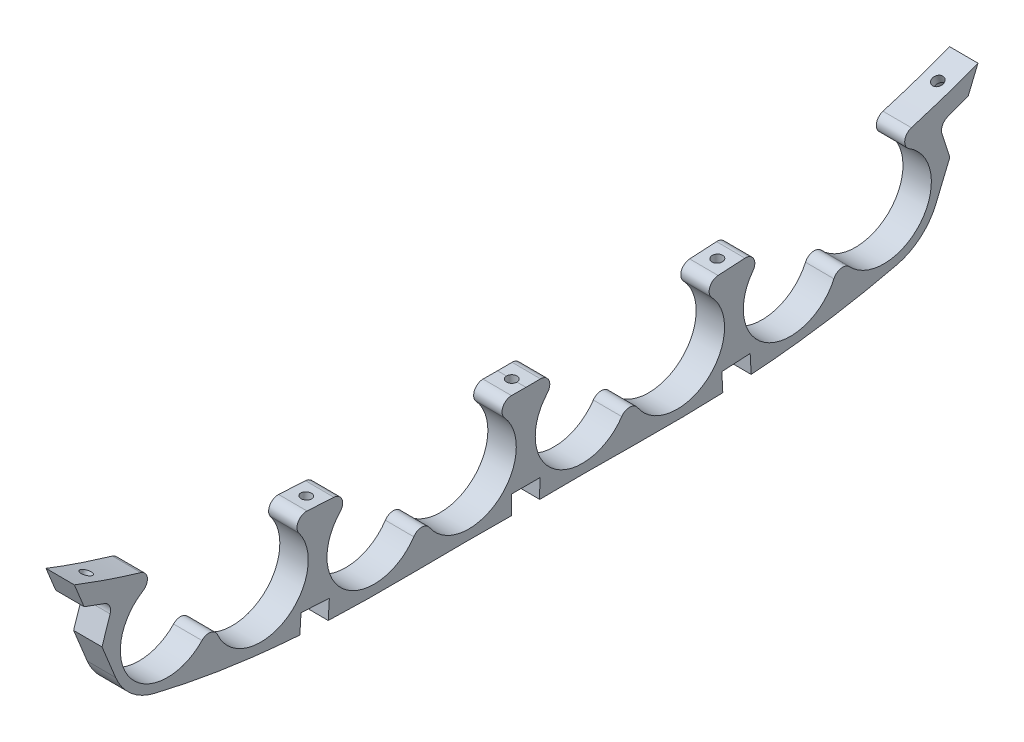
from build123d import *

# Parameters (mm, degrees)
BOSS_EXTRUDE2_START = -4.7625
BOSS_EXTRUDE2_DEPTH = 9.525
CUT_EXTRUDE1_DEPTH  = 156.415453264
SKETCH3_R           = 1.778
CUT_EXTRUDE2_DEPTH  = 156.084029674
SKETCH4_R           = 1.778
CUT_EXTRUDE3_DEPTH  = 154.633346002
SKETCH5_R           = 3.175
CUT_EXTRUDE4_DEPTH  = 3.556
SKETCH6_R           = 1.778
CUT_EXTRUDE5_DEPTH  = 141.617711282


# Read off the part's stored shape, not the designer's step: Boss-Extrude2
with BuildPart() as part:
    # Boss-Extrude2 outline → Boss-Extrude2 (new body)
    with BuildSketch(Plane(origin=(-4.793989049, 0.020738597, -8e-09), x_dir=(-1.5740645192279891e-09, 3.5988585896806374e-12, 1.0), z_dir=(-0.9999906431736159, 0.00432591784689156, -1.5740653593461668e-09)).offset(BOSS_EXTRUDE2_START)):
        with BuildLine():
            Line((-138.072044535, -17.418672385), (-133.45193308, -28.653173914))
            ThreePointArc((-133.45193308, -28.653173914), (-128.289952655, -35.791230264), (-120.447393147, -39.802732565))
            add(Edge.make_bspline(
                [(-120.447393147, -39.802732565), (-119.532951115, -40.023476944), (-117.088169027, -40.601323697), (-110.953698267, -41.968369708), (-101.9631708, -43.710437587), (-90.800466979, -45.403836777), (-79.689088478, -46.662973433), (-68.62645086, -47.527275454), (-57.58924724, -48.037878216), (-46.678774083, -48.224931934), (-36.12400945, -48.204712413), (-25.891642086, -48.098211972), (-17.621930281, -48.025348577), (-11.245188421, -48.026081616), (-6.353163032, -48.062670944), (-2.777855823, -48.097005295), (-0.863208778, -48.112845404), (-0.665350758, -48.114448781)],
                knots=[0.270797205, 0.270797205, 0.270797205, 0.270797205, 0.286422205, 0.3125, 0.375, 0.4375, 0.5, 0.5625, 0.625, 0.6875, 0.75, 0.8125, 0.875, 0.90625, 0.9375, 0.96875, 0.972344137, 0.972344137, 0.972344137, 0.972344137], degree=3))
            Line((-0.665350758, -48.114448781), (-0.665350758, -41.793027475))
            Line((-0.665350758, -41.793027475), (4.097149249, -41.793027475))
            Line((4.097149249, -41.793027475), (4.097149249, -13.091259669))
            add(Edge.make_bspline(
                [(-0.77284529, -13.060384989), (0.850702359, -13.073891325), (2.474025926, -13.085351705), (4.097149249, -13.091259669)],
                knots=[0.969923956, 0.969923956, 0.969923956, 0.969923956, 1, 1, 1, 1], degree=3))
            ThreePointArc((-0.77284529, -13.060384989), (-3.639917153, -14.954181234), (-3.104472125, -18.348273735))
            ThreePointArc((-3.104472125, -18.348273735), (-5.224674561, -41.458905114), (-28.135499878, -37.75882074))
            ThreePointArc((-28.135499878, -37.75882074), (-30.788793596, -36.352857657), (-33.427092785, -37.786760419))
            ThreePointArc((-33.427092785, -37.786760419), (-56.555344229, -41.528795139), (-58.222773785, -18.159188437))
            ThreePointArc((-58.222773785, -18.159188437), (-57.571640051, -14.813961347), (-60.325385318, -12.806125092))
            add(Edge.make_bspline(
                [(-69.337142456, -12.29114456), (-66.34151202, -12.505674943), (-63.337824033, -12.676142272), (-60.325385318, -12.806125092)],
                knots=[0.544342528, 0.544342528, 0.544342528, 0.544342528, 0.601001878, 0.601001878, 0.601001878, 0.601001878], degree=3))
            ThreePointArc((-69.337142456, -12.29114456), (-72.301979587, -13.96996524), (-72.039404171, -17.366986324))
            ThreePointArc((-72.039404171, -17.366986324), (-76.727036431, -40.596572868), (-99.26938115, -33.286970841))
            ThreePointArc((-99.26938115, -33.286970841), (-101.634862692, -31.437323087), (-104.483804941, -32.386126439))
            ThreePointArc((-104.483804941, -32.386126439), (-128.322582254, -31.527253859), (-124.396922416, -7.998247065))
            ThreePointArc((-124.396922416, -7.998247065), (-122.920666522, -4.906404126), (-125.113082538, -2.273509096))
            add(Edge.make_bspline(
                [(-147.427204302, 5.329817062), (-146.245143462, 4.87057829), (-145.060729116, 4.420056913), (-140.77844611, 2.824904825), (-137.662571865, 1.726883825), (-131.406857013, -0.357749795), (-128.269220076, -1.343570319), (-125.113082538, -2.273509096)],
                knots=[0.038524248, 0.038524248, 0.038524248, 0.038524248, 0.0625, 0.0625, 0.125, 0.125, 0.18699398, 0.18699398, 0.18699398, 0.18699398], degree=3))
            Line((-147.427204302, 5.329817062), (-144.129131172, -2.689947823))
            Line((-144.129131172, -2.689947823), (-137.314660328, -5.188999258))
            ThreePointArc((-137.314660328, -5.188999258), (-135.552656607, -6.781124671), (-135.387954249, -9.150173758))
            Line((-135.387954249, -9.150173758), (-138.072044535, -17.418672385))
        make_face()
    boss_extrude2 = extrude(amount=BOSS_EXTRUDE2_DEPTH)

    # Sketch2 → Cut-Extrude1 (cut, symmetric)
    with BuildSketch(Plane(origin=(-9.556444487, 0.041340781, -1.5e-08), x_dir=(-1.574050630268585e-09, 6.809277426616461e-12, 1.0), z_dir=(-0.9999906431736159, 0.004325917846891559, -1.5740653585248619e-09))):
        with BuildLine():
            Line((-62.07334976, -47.815401582), (-61.713409045, -41.507326545))
            Line((-61.713409045, -41.507326545), (-71.222940683, -40.964709724))
            Line((-71.222940683, -40.964709724), (-71.5828354, -47.271978618))
            add(Edge.make_bspline(
                [(-71.5828354, -47.271978618), (-70.598435188, -47.341719534), (-67.425281809, -47.552630609), (-64.255272578, -47.719817442), (-62.07334976, -47.815401582)],
                knots=[0.545807774, 0.545807774, 0.545807774, 0.545807774, 0.5625, 0.599634716, 0.599634716, 0.599634716, 0.599634716], degree=3))
        make_face()
    cut_extrude1 = extrude(amount=CUT_EXTRUDE1_DEPTH, both=True, mode=Mode.SUBTRACT)

    # Sketch3 → Cut-Extrude2 (cut, through all)
    with BuildSketch(Plane(origin=(-0.180793203, -41.792636425, 0), x_dir=(0.9999906431736159, -0.0043259178468915615, -1.3888719940127347e-14), z_dir=(-0.0043259178468915615, -0.9999906431736159, -3.2105533385859324e-12))):
        with Locations((-4.794033913, 4.097149242)):
            Circle(SKETCH3_R)
    cut_extrude2 = extrude(amount=-CUT_EXTRUDE2_DEPTH, mode=Mode.SUBTRACT)

    # Sketch4 → Cut-Extrude3 (cut, through all)
    with BuildSketch(Plane(origin=(-0.194158352, -44.882160572, -2.561013947), x_dir=(-0.9999906735399714, 0.00431187863841334, 0.00024604000093154406), z_dir=(-0.004318892575008476, -0.998366683420639, -0.05696764522603347))):
        with Locations(Location((4.777085058, 64.011158923, 0), (0, 0, 90.000000032))):
            Circle(SKETCH4_R)
    cut_extrude3 = extrude(amount=-CUT_EXTRUDE3_DEPTH, mode=Mode.SUBTRACT)

    # Sketch5 → Cut-Extrude4 (cut)
    with BuildSketch(Plane(origin=(-0.211802404, -48.960812091, -17.955426855), x_dir=(0.9999917519221775, -0.003823650309176084, -0.0013695933438228054), z_dir=(-0.004061421872744406, -0.9388491775454144, -0.3443047003377539))):
        with Locations(Location((-4.596082661, -130.968464784, 0), (0, 0, 269.998243343))):
            Circle(SKETCH5_R)
    cut_extrude4 = extrude(amount=-CUT_EXTRUDE4_DEPTH, mode=Mode.SUBTRACT)

    # Sketch6 → Cut-Extrude5 (cut, through all)
    with BuildSketch(Plane(origin=(-0.197359988, -45.622264416, -16.731079341), x_dir=(-0.9999917519221775, 0.0038236503091760845, 0.0013695933438228056), z_dir=(-0.004061421872744406, -0.9388491775454144, -0.34430470033775384))):
        with Locations(Location((4.596082661, 130.968464784, 0), (0, 0, 89.998243343))):
            Circle(SKETCH6_R)
    cut_extrude5 = extrude(amount=-CUT_EXTRUDE5_DEPTH, mode=Mode.SUBTRACT)

    # Mirror1: Boss-Extrude2, Cut-Extrude1, Cut-Extrude2, Cut-Extrude3, Cut-Extrude4, Cut-Extrude5 across plane
    add(boss_extrude2.mirror(Plane(origin=(-0.031533617, 0.000136413, 4.097149249), x_dir=(1.0, 0, 1.5740645186890284e-09), z_dir=(1.5740645186890284e-09, -3.5989831772955226e-12, -1.0))))
    add(cut_extrude1.mirror(Plane(origin=(-0.031533617, 0.000136413, 4.097149249), x_dir=(1.0, 0, 1.5740645186890284e-09), z_dir=(1.5740645186890284e-09, -3.5989831772955226e-12, -1.0))), mode=Mode.SUBTRACT)
    add(cut_extrude2.mirror(Plane(origin=(-0.031533617, 0.000136413, 4.097149249), x_dir=(1.0, 0, 1.5740645186890284e-09), z_dir=(1.5740645186890284e-09, -3.5989831772955226e-12, -1.0))), mode=Mode.SUBTRACT)
    add(cut_extrude3.mirror(Plane(origin=(-0.031533617, 0.000136413, 4.097149249), x_dir=(1.0, 0, 1.5740645186890284e-09), z_dir=(1.5740645186890284e-09, -3.5989831772955226e-12, -1.0))), mode=Mode.SUBTRACT)
    add(cut_extrude4.mirror(Plane(origin=(-0.031533617, 0.000136413, 4.097149249), x_dir=(1.0, 0, 1.5740645186890284e-09), z_dir=(1.5740645186890284e-09, -3.5989831772955226e-12, -1.0))), mode=Mode.SUBTRACT)
    add(cut_extrude5.mirror(Plane(origin=(-0.031533617, 0.000136413, 4.097149249), x_dir=(1.0, 0, 1.5740645186890284e-09), z_dir=(1.5740645186890284e-09, -3.5989831772955226e-12, -1.0))), mode=Mode.SUBTRACT)


solid = part.part
